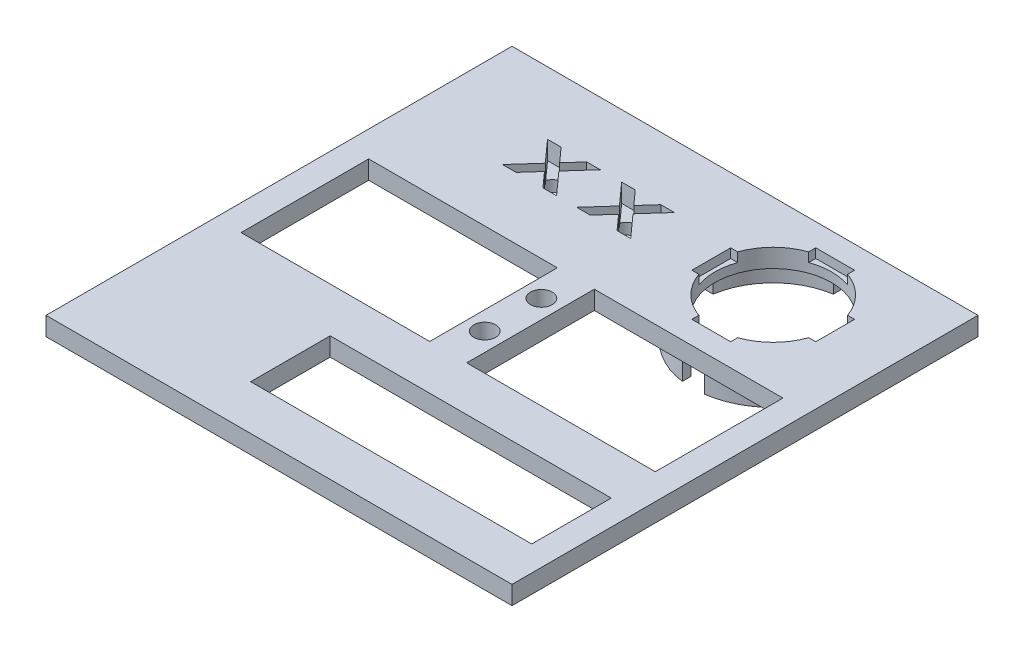
from build123d import *

# Parameters (mm, degrees)
SKETCH1_W           = 126
SKETCH1_H           = 126
BOSS_EXTRUDE1_DEPTH = 5
SKETCH4_W           = 76
SKETCH4_H           = 21.5
CUT_EXTRUDE3_DEPTH  = 10
CUT_EXTRUDE4_START  = -5
CUT_EXTRUDE4_DEPTH  = 5
SKETCH11_W          = 15
SKETCH11_H          = 13
BOSS_EXTRUDE2_DEPTH = 3
SKETCH12_R          = 2.95
CUT_EXTRUDE5_DEPTH  = 3
LPATTERN1_COUNT     = 2
LPATTERN1_PITCH     = 20
LPATTERN2_COUNT     = 2
LPATTERN2_PITCH     = 20
SKETCH13_W          = 51
SKETCH13_H          = 34.5
CUT_EXTRUDE6_DEPTH  = 179.370401132
SKETCH14_W          = 51
SKETCH14_H          = 34.5
CUT_EXTRUDE7_DEPTH  = 179.370401132
SKETCH17_R          = 2.95
CUT_EXTRUDE10_DEPTH = 179.370401132
SKETCH18_R          = 21.778665512
SKETCH18_R_2        = 19.5
BOSS_EXTRUDE3_DEPTH = 6
SKETCH19_W          = 44.860431558
SKETCH19_H          = 6
SKETCH19_W_2        = 6
SKETCH19_H_2        = 44.549983506
CUT_EXTRUDE11_DEPTH = 6
SKETCH21_R          = 15.75
CUT_EXTRUDE14_DEPTH = 179.530109505
CUT_EXTRUDE15_DEPTH = 2.5


# Read off the part's stored shape, not the designer's step: Cut-Extrude4
with BuildPart() as part:
    # Sketch1 → Boss-Extrude1 (new body)
    with BuildSketch(Plane(origin=(0, 0, 0), x_dir=(1, 0, 0), z_dir=(0, 1, 0))):
        with Locations((63, 63)):
            Rectangle(SKETCH1_W, SKETCH1_H)
    extrude(amount=BOSS_EXTRUDE1_DEPTH)

    # Sketch4 → Cut-Extrude3 (cut)
    with BuildSketch(Plane(origin=(0, 5, 0), x_dir=(1, 0, 0), z_dir=(0, 1, 0))):
        with Locations((81.213909597, 22.875)):
            Rectangle(SKETCH4_W, SKETCH4_H)
    extrude(amount=-CUT_EXTRUDE3_DEPTH, mode=Mode.SUBTRACT)

    # Cut-Extrude4 outline → Cut-Extrude4 (cut)
    with BuildSketch(Plane(origin=(0, 5, 0), x_dir=(1, 0, 0), z_dir=(0, 1, 0)).offset(CUT_EXTRUDE4_START)):
        Polygon((46.623568796, 109.033538796), (51.912030335, 103.132096488), (46.436068796, 97.033538796), (50.116357258, 97.033538796), (53.750972642, 101.079211873), (57.375972642, 97.033538796), (61.051453412, 97.033538796), (55.58991495, 103.129692642), (60.892799565, 109.033538796), (57.210107258, 109.033538796), (53.750972642, 105.180173411), (50.299049565, 109.033538796), align=None)
        Polygon((26.586259271, 109.023073742), (31.87472081, 103.121631435), (26.398759271, 97.023073742), (30.079047733, 97.023073742), (33.713663117, 101.068746819), (37.338663117, 97.023073742), (41.014143886, 97.023073742), (35.552605425, 103.119227588), (40.85549004, 109.023073742), (37.172797733, 109.023073742), (33.713663117, 105.169708358), (30.26174004, 109.023073742), align=None)
    extrude(amount=CUT_EXTRUDE4_DEPTH, mode=Mode.SUBTRACT)

    # Sketch11 → Boss-Extrude2 (add)
    with BuildSketch(Plane.XZ):
        with Locations((53.750972642, -103.129692642)):
            Rectangle(SKETCH11_W, SKETCH11_H)
    boss_extrude2 = extrude(amount=BOSS_EXTRUDE2_DEPTH)

    # Sketch12 → Cut-Extrude5 (cut)
    with BuildSketch(Plane.XZ.offset(3)):
        with Locations(Location((53.750972642, -103.129692642, 0), (0, 0, 270))):
            Circle(SKETCH12_R)
    cut_extrude5 = extrude(amount=-CUT_EXTRUDE5_DEPTH, mode=Mode.SUBTRACT)

    # LPattern1: Boss-Extrude2 ×2
    with Locations(*[(-i * LPATTERN1_PITCH, 0, 0) for i in range(1, LPATTERN1_COUNT)]):
        add(boss_extrude2)

    # LPattern2: Cut-Extrude5 ×2
    with Locations(*[(-i * LPATTERN2_PITCH, 0, 0) for i in range(1, LPATTERN2_COUNT)]):
        add(cut_extrude5, mode=Mode.SUBTRACT)

    # Sketch13 → Cut-Extrude6 (cut, through all)
    with BuildSketch(Plane(origin=(0, 5, 0), x_dir=(1, 0, 0), z_dir=(0, 1, 0))):
        with Locations((32.5, 63)):
            Rectangle(SKETCH13_W, SKETCH13_H)
    extrude(amount=-CUT_EXTRUDE6_DEPTH, mode=Mode.SUBTRACT)

    # Sketch14 → Cut-Extrude7 (cut, through all)
    with BuildSketch(Plane(origin=(0, 5, 0), x_dir=(1, 0, 0), z_dir=(0, 1, 0))):
        with Locations((93.5, 63)):
            Rectangle(SKETCH14_W, SKETCH14_H)
    extrude(amount=-CUT_EXTRUDE7_DEPTH, mode=Mode.SUBTRACT)

    # Sketch17 → Cut-Extrude10 (cut, through all)
    with BuildSketch(Plane(origin=(0, 5, 0), x_dir=(1, 0, 0), z_dir=(0, 1, 0))):
        with Locations(Location((63, 55.625, 0), (0, 0, 270))):
            Circle(SKETCH17_R)
        with Locations(Location((63, 70.940065171, 0), (0, 0, 270))):
            Circle(SKETCH17_R)
    extrude(amount=-CUT_EXTRUDE10_DEPTH, mode=Mode.SUBTRACT)

    # Sketch18 → Boss-Extrude3 (add)
    with BuildSketch(Plane.XZ):
        with Locations(Location((93.5, -103.125, 0), (0, 0, 270))):
            Circle(SKETCH18_R)
        with Locations(Location((93.5, -103.125, 0), (0, 0, 270))):
            Circle(SKETCH18_R_2, mode=Mode.SUBTRACT)
    extrude(amount=BOSS_EXTRUDE3_DEPTH)

    # Sketch19 → Cut-Extrude11 (cut)
    with BuildSketch(Plane.XZ.offset(6)):
        with Locations((93.5, -103.125)):
            Rectangle(SKETCH19_W, SKETCH19_H)
        with Locations((93.5, -103.125)):
            Rectangle(SKETCH19_W_2, SKETCH19_H_2)
    extrude(amount=-CUT_EXTRUDE11_DEPTH, mode=Mode.SUBTRACT)

    # Sketch21 → Cut-Extrude14 (cut, through all)
    with BuildSketch(Plane(origin=(0, 5, 0), x_dir=(1, 0, 0), z_dir=(0, 1, 0))):
        with Locations(Location((93.5, 103.125, 0), (0, 0, 270))):
            Circle(SKETCH21_R)
    extrude(amount=-CUT_EXTRUDE14_DEPTH, mode=Mode.SUBTRACT)

    # Sketch22 → Cut-Extrude15 (cut)
    with BuildSketch(Plane(origin=(0, 5, 0), x_dir=(1, 0, 0), z_dir=(0, 1, 0))):
        with BuildLine():
            ThreePointArc((78.650757595, 97.875), (77.75, 103.125), (78.650757595, 108.375))
            Line((78.650757595, 108.375), (76.75, 108.375))
            Line((76.75, 108.375), (76.75, 97.875))
            Line((76.75, 97.875), (78.650757595, 97.875))
        make_face()
        with BuildLine():
            ThreePointArc((88.25, 117.974242405), (93.5, 118.875), (98.75, 117.974242405))
            Line((98.75, 117.974242405), (98.75, 119.875))
            Line((98.75, 119.875), (88.25, 119.875))
            Line((88.25, 119.875), (88.25, 117.974242405))
        make_face()
        with BuildLine():
            Line((110.25, 97.875), (110.25, 108.375))
            Line((110.25, 108.375), (108.349242405, 108.375))
            ThreePointArc((108.349242405, 108.375), (109.023177315, 105.788356165), (109.25, 103.125))
            ThreePointArc((109.25, 103.125), (109.023177315, 100.461643835), (108.349242405, 97.875))
            Line((108.349242405, 97.875), (110.25, 97.875))
        make_face()
        with BuildLine():
            Line((98.75, 86.375), (98.75, 88.275757595))
            ThreePointArc((98.75, 88.275757595), (93.5, 87.375), (88.25, 88.275757595))
            Line((88.25, 88.275757595), (88.25, 86.375))
            Line((88.25, 86.375), (98.75, 86.375))
        make_face()
    extrude(amount=-CUT_EXTRUDE15_DEPTH, mode=Mode.SUBTRACT)


solid = part.part
